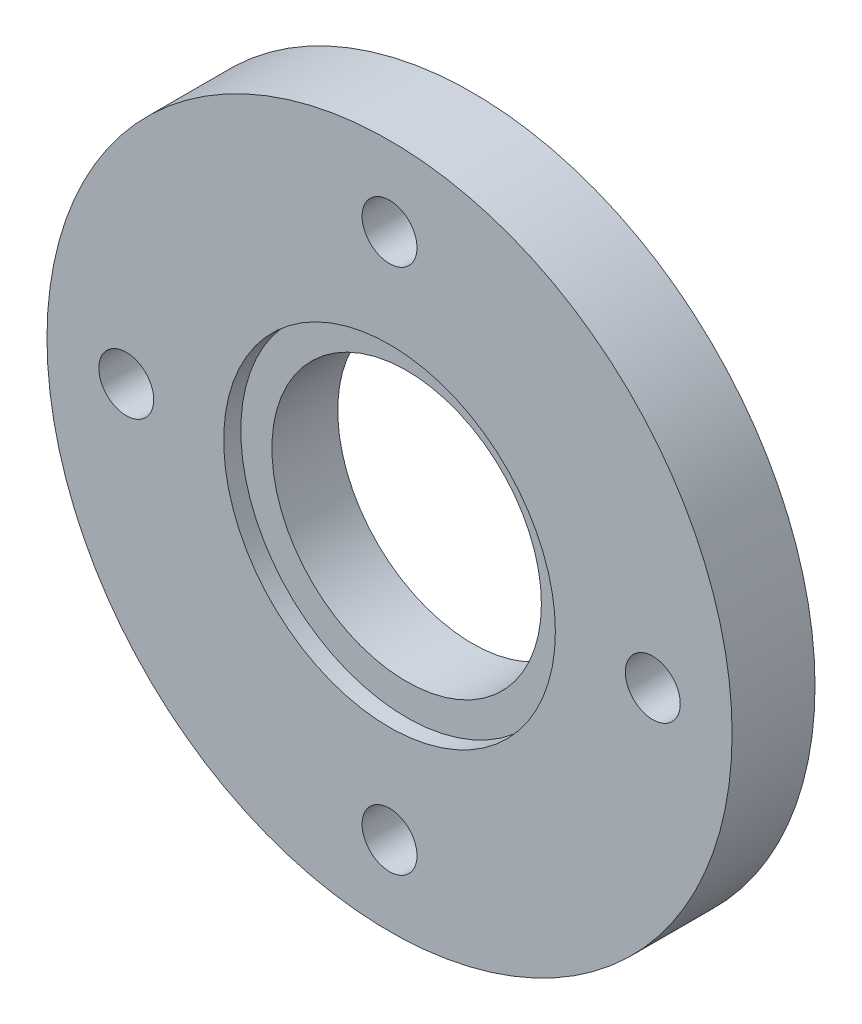
from build123d import *

# Parameters (mm, degrees)
SKETCH1_R           = 33.05
SKETCH1_R_2         = 13
BOSS_EXTRUDE1_DEPTH = 8
SKETCH1_10_R        = 16
SKETCH1_10_R_2      = 13
CUT_EXTRUDE1_DEPTH  = 1.65
SKETCH8_R           = 2.5
CUT_EXTRUDE2_DEPTH  = 4.1
CIRPATTERN1_COUNT   = 4
SKETCH9_R           = 2.65
CUT_EXTRUDE3_DEPTH  = 8
CIRPATTERN2_COUNT   = 4


with BuildPart() as part:
    # Sketch1 → Boss-Extrude1 (new body)
    with BuildSketch(Plane.XY):
        Circle(SKETCH1_R)
        Circle(SKETCH1_R_2, mode=Mode.SUBTRACT)
    extrude(amount=-BOSS_EXTRUDE1_DEPTH)

    # Sketch1<10> → Cut-Extrude1 (cut)
    with BuildSketch(Plane.XY):
        Circle(SKETCH1_10_R)
        Circle(SKETCH1_10_R_2, mode=Mode.SUBTRACT)
    extrude(amount=-CUT_EXTRUDE1_DEPTH, mode=Mode.SUBTRACT)

    # Sketch8 → Cut-Extrude2 (cut)
    with BuildSketch(Plane(origin=(0, 0, -8), x_dir=(-1, 0, 0), z_dir=(0, 0, -1))):
        with Locations((-59.896098373, -103.852081394)):
            Circle(SKETCH8_R)
        with Locations((-77.856610615, -96.412593637)):
            Circle(SKETCH8_R)
        with Locations((-85.296098373, -78.452081395)):
            Circle(SKETCH8_R)
        with Locations((-77.856610615, -60.491569152)):
            Circle(SKETCH8_R)
        with Locations((-59.896098373, -53.052081395)):
            Circle(SKETCH8_R)
        with Locations((-41.935586131, -60.491569152)):
            Circle(SKETCH8_R)
        with Locations((-34.496098373, -78.452081395)):
            Circle(SKETCH8_R)
        with Locations((-41.935586131, -96.412593637)):
            Circle(SKETCH8_R)
        Polygon((2.482606158, 21.1), (4.965212315, 25.4), (2.482606158, 29.7), (-2.482606158, 29.7), (-4.965212315, 25.4), (-2.482606158, 21.1), align=None)
    cut_extrude2 = extrude(amount=-CUT_EXTRUDE2_DEPTH, mode=Mode.SUBTRACT)

    # CirPattern1: Cut-Extrude2 ×4 about axis
    cirpattern1_axis = Axis((0, 0, -8), (0, 0, 1))
    for i in range(1, CIRPATTERN1_COUNT):
        add(cut_extrude2.rotate(cirpattern1_axis, i * 360 / CIRPATTERN1_COUNT), mode=Mode.SUBTRACT)

    # Sketch9 → Cut-Extrude3 (cut)
    with BuildSketch(Plane(origin=(0, 0, -8), x_dir=(-1, 0, 0), z_dir=(0, 0, -1))):
        with Locations((0, 25.4)):
            Circle(SKETCH9_R)
    cut_extrude3 = extrude(amount=-CUT_EXTRUDE3_DEPTH, mode=Mode.SUBTRACT)

    # CirPattern2: Cut-Extrude3 ×4 about axis
    cirpattern2_axis = Axis((0, 0, -8), (0, 0, 1))
    for i in range(1, CIRPATTERN2_COUNT):
        add(cut_extrude3.rotate(cirpattern2_axis, i * 360 / CIRPATTERN2_COUNT), mode=Mode.SUBTRACT)


solid = part.part
